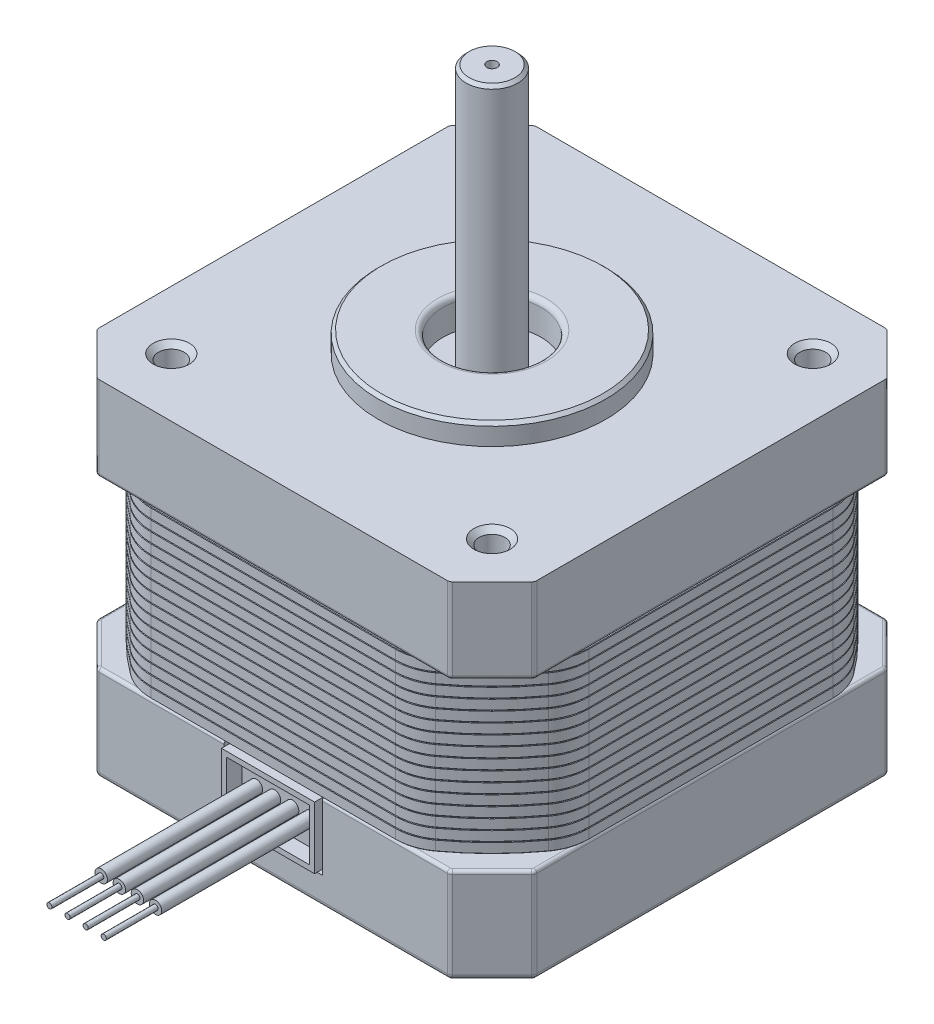
from build123d import *

# Parameters (mm, degrees)
EXTRUDE_1_DEPTH        = 9.2
EXTRUDE_START          = 33.4
EXTRUDE_2_DEPTH        = 8.2
EXTRUDE_3_DEPTH        = 1
PATTERN_LINEAR_1_COUNT = 16
PATTERN_LINEAR_1_PITCH = 1
SKETCH_3_R             = 4.75
CUT_EXTRUDE_1_DEPTH    = 3
SKETCH_4_R             = 4.75
SKETCH_4_R_2           = 2.5
CUT_EXTRUDE_2_DEPTH    = 0.5
SKETCH_5_R             = 0.5
CUT_EXTRUDE_3_DEPTH    = 0.5
CHAMFER_1_SIZE         = 0.3
FILLET_1_R             = 0.5
FILLET_2_R             = 0.5
SKETCH_6_R             = 11
SKETCH_6_R_2           = 4.75
EXTRUDE_4_DEPTH        = 2
CUT_EXTRUDE_START      = -1
SKETCH_7_R             = 4.75
CUT_EXTRUDE_4_DEPTH    = 1
CHAMFER_2_SIZE         = 0.3
FILLET_3_R             = 0.5
SKETCH_8_R             = 2.5
EXTRUDE_5_DEPTH        = 25.2
CHAMFER_4_SIZE         = 0.3
SKETCH_9_R             = 0.5
CUT_EXTRUDE_5_DEPTH    = 1
SKETCH_10_W            = 9.5
SKETCH_10_H            = 6.5
CUT_EXTRUDE_6_DEPTH    = 1
SKETCH_11_W            = 9
SKETCH_11_H            = 6
SKETCH_11_W_2          = 8
SKETCH_11_H_2          = 5
EXTRUDE_6_DEPTH        = 1.5
SKETCH_12_R            = 0.6
SKETCH_12_R_2          = 0.25
EXTRUDE_7_DEPTH        = 15
EXTRUDE_7_2_DEPTH      = 15
EXTRUDE_7_3_DEPTH      = 15
EXTRUDE_7_4_DEPTH      = 15
SKETCH_12_2_R          = 0.25
EXTRUDE_8_DEPTH        = 20
EXTRUDE_8_2_DEPTH      = 20
EXTRUDE_8_3_DEPTH      = 20
EXTRUDE_8_4_DEPTH      = 20
CHAMFER_19_SIZE        = 0.05
CHAMFER_20_SIZE        = 0.05
CHAMFER_21_SIZE        = 0.05
CHAMFER_22_SIZE        = 0.05
CHAMFER_23_SIZE        = 0.05
CHAMFER_24_SIZE        = 0.05
CHAMFER_25_SIZE        = 0.05
CHAMFER_26_SIZE        = 0.05
CHAMFER_27_SIZE        = 0.05
CHAMFER_28_SIZE        = 0.05
CHAMFER_29_SIZE        = 0.05
CHAMFER_30_SIZE        = 0.05
CHAMFER_31_SIZE        = 0.05
CHAMFER_32_SIZE        = 0.05
CHAMFER_33_SIZE        = 0.05
CHAMFER_34_SIZE        = 0.05
SKETCH_16_R            = 1.25
CUT_EXTRUDE_9_DEPTH    = 7
CHAMFER_35_SIZE        = 0.5
FILLET_4_R             = 0.3
FILLET_5_R             = 0.3


with BuildPart() as part:
    # Эскиз1 → Бобышка-Вытянуть1 (new body)
    with BuildSketch(Plane(origin=(0, 0, 0), x_dir=(1, 0, 0), z_dir=(0, 1, 0))):
        Polygon((-17.033766184, 21.15), (-21.15, 17.033766184), (-21.15, -17.033766184), (-17.033766184, -21.15), (17.033766184, -21.15), (21.15, -17.033766184), (21.15, 17.033766184), (17.033766184, 21.15), align=None)
    extrude(amount=EXTRUDE_1_DEPTH)

    # Эскиз3 → Вырез-Вытянуть1 (cut)
    with BuildSketch(Plane.XZ):
        with Locations(Location((0, 0, 0), (0, 0, 270))):
            Circle(SKETCH_3_R)
    extrude(amount=-CUT_EXTRUDE_1_DEPTH, mode=Mode.SUBTRACT)

    # Эскиз4 → Вырез-Вытянуть2 (cut)
    with BuildSketch(Plane.XZ.offset(-3)):
        with Locations(Location((0, 0, 0), (0, 0, 270))):
            Circle(SKETCH_4_R)
        with Locations(Location((0, 0, 0), (0, 0, 270))):
            Circle(SKETCH_4_R_2, mode=Mode.SUBTRACT)
    extrude(amount=-CUT_EXTRUDE_2_DEPTH, mode=Mode.SUBTRACT)

    # Эскиз5 → Вырез-Вытянуть3 (cut)
    with BuildSketch(Plane.XZ.offset(-3)):
        with Locations(Location((0, 0, 0), (0, 0, 270))):
            Circle(SKETCH_5_R)
    extrude(amount=-CUT_EXTRUDE_3_DEPTH, mode=Mode.SUBTRACT)

    # Фаска1
    chamfer_1_edges = [part.edges().sort_by_distance(p)[0] for p in [
        (0, 3, 2.5),
    ]]
    chamfer(chamfer_1_edges, length=CHAMFER_1_SIZE)

    # Скругление1
    fillet_1_edges = [part.edges().sort_by_distance(p)[0] for p in [
        (-21.15, 0, 0),
        (-19.091883092, 0, -19.091883092),
        (0, 0, -21.15),
        (19.091883092, 0, -19.091883092),
        (21.15, 0, 0),
        (19.091883092, 0, 19.091883092),
        (0, 0, 21.15),
        (-19.091883092, 0, 19.091883092),
        (-21.15, 4.6, 17.033766184),
        (-21.15, 4.6, -17.033766184),
        (-17.033766184, 4.6, -21.15),
        (17.033766184, 4.6, -21.15),
        (21.15, 4.6, -17.033766184),
        (21.15, 4.6, 17.033766184),
        (17.033766184, 4.6, 21.15),
        (-17.033766184, 4.6, 21.15),
        (0, 0, 4.75),
    ]]
    fillet(fillet_1_edges, radius=FILLET_1_R)

    # Эскиз10 → Вырез-Вытянуть6 (cut)
    with BuildSketch(Plane.XY.offset(21.15)):
        with Locations((0, 5.95)):
            Rectangle(SKETCH_10_W, SKETCH_10_H)
    extrude(amount=-CUT_EXTRUDE_6_DEPTH, mode=Mode.SUBTRACT)

    # Скругление4
    fillet_4_edges = [part.edges().sort_by_distance(p)[0] for p in [
        (10.788329701, 9.2, 21.15),
        (-10.788329701, 9.2, 21.15),
        (19.091883092, 9.2, 19.091883092),
        (21.15, 9.2, 0),
        (19.091883092, 9.2, -19.091883092),
        (0, 9.2, -21.15),
        (-19.091883092, 9.2, -19.091883092),
        (-21.15, 9.2, 0),
        (-19.091883092, 9.2, 19.091883092),
        (21.111939766, 9.2, -17.018001119),
        (17.018001119, 9.2, -21.111939766),
        (-17.018001119, 9.2, -21.111939766),
        (-21.111939766, 9.2, -17.018001119),
        (-21.111939766, 9.2, 17.018001119),
        (-17.018001119, 9.2, 21.111939766),
        (17.018001119, 9.2, 21.111939766),
        (21.111939766, 9.2, 17.018001119),
    ]]
    fillet(fillet_4_edges, radius=FILLET_4_R)


with BuildPart() as body_2:
    # Эскиз1<3> → Бобышка-Вытянуть2 (new body)
    with BuildSketch(Plane(origin=(0, 0, 0), x_dir=(1, 0, 0), z_dir=(0, 1, 0)).offset(EXTRUDE_START)):
        Polygon((-17.033766184, 21.15), (-21.15, 17.033766184), (-21.15, -17.033766184), (-17.033766184, -21.15), (17.033766184, -21.15), (21.15, -17.033766184), (21.15, 17.033766184), (17.033766184, 21.15), align=None)
    extrude(amount=-EXTRUDE_2_DEPTH)

    # Скругление2
    fillet_2_edges = [body_2.edges().sort_by_distance(p)[0] for p in [
        (-21.15, 29.3, 17.033766184),
        (-21.15, 29.3, -17.033766184),
        (-17.033766184, 29.3, -21.15),
        (17.033766184, 29.3, -21.15),
        (21.15, 29.3, -17.033766184),
        (21.15, 29.3, 17.033766184),
        (17.033766184, 29.3, 21.15),
        (-17.033766184, 29.3, 21.15),
    ]]
    fillet(fillet_2_edges, radius=FILLET_2_R)

    # Эскиз6 → Бобышка-Вытянуть4 (add)
    with BuildSketch(Plane(origin=(0, 33.4, 0), x_dir=(1, 0, 0), z_dir=(0, 1, 0))):
        with Locations(Location((0, 0, 0), (0, 0, 270))):
            Circle(SKETCH_6_R)
        with Locations(Location((0, 0, 0), (0, 0, 270))):
            Circle(SKETCH_6_R_2, mode=Mode.SUBTRACT)
    extrude(amount=EXTRUDE_4_DEPTH)

    # Эскиз7 → Вырез-Вытянуть4 (cut)
    with BuildSketch(Plane(origin=(0, 33.4, 0), x_dir=(1, 0, 0), z_dir=(0, 1, 0)).offset(CUT_EXTRUDE_START)):
        with Locations(Location((0, 0, 0), (0, 0, 270))):
            Circle(SKETCH_7_R)
    extrude(amount=CUT_EXTRUDE_4_DEPTH, mode=Mode.SUBTRACT)

    # Фаска2
    chamfer_2_edges = [body_2.edges().sort_by_distance(p)[0] for p in [
        (0, 35.4, -11),
    ]]
    chamfer(chamfer_2_edges, length=CHAMFER_2_SIZE)

    # Скругление3
    fillet_3_edges = [body_2.edges().sort_by_distance(p)[0] for p in [
        (0, 35.4, -4.75),
    ]]
    fillet(fillet_3_edges, radius=FILLET_3_R)

    # Эскиз8 → Бобышка-Вытянуть5 (add)
    with BuildSketch(Plane(origin=(0, 32.4, 0), x_dir=(1, 0, 0), z_dir=(0, 1, 0))):
        with Locations(Location((0, 0, 0), (0, 0, 270))):
            Circle(SKETCH_8_R)
    extrude(amount=EXTRUDE_5_DEPTH)

    # Фаска4
    chamfer_4_edges = [body_2.edges().sort_by_distance(p)[0] for p in [
        (0, 57.6, -2.5),
    ]]
    chamfer(chamfer_4_edges, length=CHAMFER_4_SIZE)

    # Эскиз9 → Вырез-Вытянуть5 (cut)
    with BuildSketch(Plane(origin=(0, 57.6, 0), x_dir=(1, 0, 0), z_dir=(0, 1, 0)).offset(CUT_EXTRUDE_START)):
        with Locations(Location((0, 0, 0), (0, 0, 270))):
            Circle(SKETCH_9_R)
    extrude(amount=CUT_EXTRUDE_5_DEPTH, mode=Mode.SUBTRACT)

    # Эскиз16 → Вырез-Вытянуть9 (cut)
    with BuildSketch(Plane(origin=(0, 33.4, 0), x_dir=(1, 0, 0), z_dir=(0, 1, 0))):
        with Locations(Location((-15.5, 15.5, 0), (0, 0, 270))):
            Circle(SKETCH_16_R)
        with Locations(Location((15.5, 15.5, 0), (0, 0, 270))):
            Circle(SKETCH_16_R)
        with Locations(Location((15.5, -15.5, 0), (0, 0, 270))):
            Circle(SKETCH_16_R)
        with Locations(Location((-15.5, -15.5, 0), (0, 0, 270))):
            Circle(SKETCH_16_R)
    extrude(amount=-CUT_EXTRUDE_9_DEPTH, mode=Mode.SUBTRACT)

    # Фаска35
    chamfer_35_edges = [body_2.edges().sort_by_distance(p)[0] for p in [
        (-15.5, 33.4, -16.75),
        (15.5, 33.4, -16.75),
        (15.5, 33.4, 14.25),
        (-15.5, 33.4, 14.25),
    ]]
    chamfer(chamfer_35_edges, length=CHAMFER_35_SIZE)

    # Скругление5
    fillet_5_edges = [body_2.edges().sort_by_distance(p)[0] for p in [
        (19.091883092, 25.2, 19.091883092),
        (21.15, 25.2, 0),
        (-19.091883092, 25.2, 19.091883092),
        (-21.15, 25.2, 0),
        (-19.091883092, 25.2, -19.091883092),
        (0, 25.2, -21.15),
        (19.091883092, 25.2, -19.091883092),
        (0, 25.2, 21.15),
        (21.111939766, 25.2, -17.018001119),
        (17.018001119, 25.2, -21.111939766),
        (-17.018001119, 25.2, -21.111939766),
        (-21.111939766, 25.2, -17.018001119),
        (-21.111939766, 25.2, 17.018001119),
        (-17.018001119, 25.2, 21.111939766),
        (17.018001119, 25.2, 21.111939766),
        (21.111939766, 25.2, 17.018001119),
    ]]
    fillet(fillet_5_edges, radius=FILLET_5_R)


with BuildPart() as body_3:
    # Эскиз2 → Бобышка-Вытянуть3 (new body)
    with BuildSketch(Plane(origin=(0, 9.2, 0), x_dir=(1, 0, 0), z_dir=(0, 1, 0))):
        with BuildLine():
            Line((-11.797351398, -21.15), (11.797351398, -21.15))
            ThreePointArc((11.797351398, -21.15), (13.348560603, -20.903288335), (14.746689247, -20.1875))
            ThreePointArc((14.746689247, -20.1875), (17.67766953, -17.67766953), (20.1875, -14.746689247))
            ThreePointArc((20.1875, -14.746689247), (20.903288335, -13.348560603), (21.15, -11.797351398))
            Line((21.15, -11.797351398), (21.15, 11.797351398))
            ThreePointArc((21.15, 11.797351398), (20.903288335, 13.348560603), (20.1875, 14.746689247))
            ThreePointArc((20.1875, 14.746689247), (17.67766953, 17.67766953), (14.746689247, 20.1875))
            ThreePointArc((14.746689247, 20.1875), (13.348560603, 20.903288335), (11.797351398, 21.15))
            Line((11.797351398, 21.15), (-11.797351398, 21.15))
            ThreePointArc((-11.797351398, 21.15), (-13.348560603, 20.903288335), (-14.746689247, 20.1875))
            ThreePointArc((-14.746689247, 20.1875), (-17.67766953, 17.67766953), (-20.1875, 14.746689247))
            ThreePointArc((-20.1875, 14.746689247), (-20.903288335, 13.348560603), (-21.15, 11.797351398))
            Line((-21.15, 11.797351398), (-21.15, -11.797351398))
            ThreePointArc((-21.15, -11.797351398), (-20.903288335, -13.348560603), (-20.1875, -14.746689247))
            ThreePointArc((-20.1875, -14.746689247), (-17.67766953, -17.67766953), (-14.746689247, -20.1875))
            ThreePointArc((-14.746689247, -20.1875), (-13.348560603, -20.903288335), (-11.797351398, -21.15))
        make_face()
    extrude(amount=EXTRUDE_3_DEPTH)


with BuildPart() as pattern_linear_1_1:
    # Линейный массив1: pattern copy
    add(body_3.part.moved(Location(Vector(0, 1, 0) * (1 * PATTERN_LINEAR_1_PITCH))))

    # Фаска33
    chamfer_33_edges = [pattern_linear_1_1.edges().sort_by_distance(p)[0] for p in [
        (-13.348560603, 11.2, -20.903288335),
        (-17.67766953, 11.2, -17.67766953),
        (17.67766953, 10.2, -17.67766953),
        (20.903288335, 10.2, -13.348560603),
        (21.15, 10.2, 0),
        (20.903288335, 10.2, 13.348560603),
        (17.67766953, 10.2, 17.67766953),
        (-20.903288335, 11.2, -13.348560603),
        (13.348560603, 10.2, 20.903288335),
        (0, 10.2, 21.15),
        (-13.348560603, 10.2, 20.903288335),
        (-17.67766953, 10.2, 17.67766953),
        (-20.903288335, 10.2, 13.348560603),
        (-21.15, 10.2, 0),
        (-20.903288335, 10.2, -13.348560603),
        (-17.67766953, 10.2, -17.67766953),
        (-21.15, 11.2, 0),
        (-13.348560603, 10.2, -20.903288335),
        (0, 10.2, -21.15),
        (13.348560603, 10.2, -20.903288335),
        (-20.903288335, 11.2, 13.348560603),
        (-17.67766953, 11.2, 17.67766953),
        (-13.348560603, 11.2, 20.903288335),
        (0, 11.2, 21.15),
        (13.348560603, 11.2, 20.903288335),
        (17.67766953, 11.2, 17.67766953),
        (13.348560603, 11.2, -20.903288335),
        (20.903288335, 11.2, 13.348560603),
        (21.15, 11.2, 0),
        (20.903288335, 11.2, -13.348560603),
        (17.67766953, 11.2, -17.67766953),
        (0, 11.2, -21.15),
    ]]
    chamfer(chamfer_33_edges, length=CHAMFER_33_SIZE)


with BuildPart() as pattern_linear_1_2:
    # Линейный массив1: pattern copy
    add(body_3.part.moved(Location(Vector(0, 1, 0) * (2 * PATTERN_LINEAR_1_PITCH))))

    # Фаска32
    chamfer_32_edges = [pattern_linear_1_2.edges().sort_by_distance(p)[0] for p in [
        (-13.348560603, 12.2, -20.903288335),
        (-17.67766953, 12.2, -17.67766953),
        (17.67766953, 11.2, -17.67766953),
        (20.903288335, 11.2, -13.348560603),
        (21.15, 11.2, 0),
        (20.903288335, 11.2, 13.348560603),
        (17.67766953, 11.2, 17.67766953),
        (-20.903288335, 12.2, -13.348560603),
        (13.348560603, 11.2, 20.903288335),
        (0, 11.2, 21.15),
        (-13.348560603, 11.2, 20.903288335),
        (-17.67766953, 11.2, 17.67766953),
        (-20.903288335, 11.2, 13.348560603),
        (-21.15, 11.2, 0),
        (-20.903288335, 11.2, -13.348560603),
        (-17.67766953, 11.2, -17.67766953),
        (-21.15, 12.2, 0),
        (-13.348560603, 11.2, -20.903288335),
        (0, 11.2, -21.15),
        (13.348560603, 11.2, -20.903288335),
        (-20.903288335, 12.2, 13.348560603),
        (-17.67766953, 12.2, 17.67766953),
        (-13.348560603, 12.2, 20.903288335),
        (0, 12.2, 21.15),
        (13.348560603, 12.2, 20.903288335),
        (17.67766953, 12.2, 17.67766953),
        (13.348560603, 12.2, -20.903288335),
        (20.903288335, 12.2, 13.348560603),
        (21.15, 12.2, 0),
        (20.903288335, 12.2, -13.348560603),
        (17.67766953, 12.2, -17.67766953),
        (0, 12.2, -21.15),
    ]]
    chamfer(chamfer_32_edges, length=CHAMFER_32_SIZE)


with BuildPart() as pattern_linear_1_3:
    # Линейный массив1: pattern copy
    add(body_3.part.moved(Location(Vector(0, 1, 0) * (3 * PATTERN_LINEAR_1_PITCH))))

    # Фаска31
    chamfer_31_edges = [pattern_linear_1_3.edges().sort_by_distance(p)[0] for p in [
        (-13.348560603, 13.2, -20.903288335),
        (-17.67766953, 13.2, -17.67766953),
        (17.67766953, 12.2, -17.67766953),
        (20.903288335, 12.2, -13.348560603),
        (21.15, 12.2, 0),
        (20.903288335, 12.2, 13.348560603),
        (17.67766953, 12.2, 17.67766953),
        (-20.903288335, 13.2, -13.348560603),
        (13.348560603, 12.2, 20.903288335),
        (0, 12.2, 21.15),
        (-13.348560603, 12.2, 20.903288335),
        (-17.67766953, 12.2, 17.67766953),
        (-20.903288335, 12.2, 13.348560603),
        (-21.15, 12.2, 0),
        (-20.903288335, 12.2, -13.348560603),
        (-17.67766953, 12.2, -17.67766953),
        (-21.15, 13.2, 0),
        (-13.348560603, 12.2, -20.903288335),
        (0, 12.2, -21.15),
        (13.348560603, 12.2, -20.903288335),
        (-20.903288335, 13.2, 13.348560603),
        (-17.67766953, 13.2, 17.67766953),
        (-13.348560603, 13.2, 20.903288335),
        (0, 13.2, 21.15),
        (13.348560603, 13.2, 20.903288335),
        (17.67766953, 13.2, 17.67766953),
        (13.348560603, 13.2, -20.903288335),
        (20.903288335, 13.2, 13.348560603),
        (21.15, 13.2, 0),
        (20.903288335, 13.2, -13.348560603),
        (17.67766953, 13.2, -17.67766953),
        (0, 13.2, -21.15),
    ]]
    chamfer(chamfer_31_edges, length=CHAMFER_31_SIZE)


with BuildPart() as pattern_linear_1_4:
    # Линейный массив1: pattern copy
    add(body_3.part.moved(Location(Vector(0, 1, 0) * (4 * PATTERN_LINEAR_1_PITCH))))

    # Фаска30
    chamfer_30_edges = [pattern_linear_1_4.edges().sort_by_distance(p)[0] for p in [
        (-13.348560603, 14.2, -20.903288335),
        (-17.67766953, 14.2, -17.67766953),
        (17.67766953, 13.2, -17.67766953),
        (20.903288335, 13.2, -13.348560603),
        (21.15, 13.2, 0),
        (20.903288335, 13.2, 13.348560603),
        (17.67766953, 13.2, 17.67766953),
        (-20.903288335, 14.2, -13.348560603),
        (13.348560603, 13.2, 20.903288335),
        (0, 13.2, 21.15),
        (-13.348560603, 13.2, 20.903288335),
        (-17.67766953, 13.2, 17.67766953),
        (-20.903288335, 13.2, 13.348560603),
        (-21.15, 13.2, 0),
        (-20.903288335, 13.2, -13.348560603),
        (-17.67766953, 13.2, -17.67766953),
        (-21.15, 14.2, 0),
        (-13.348560603, 13.2, -20.903288335),
        (0, 13.2, -21.15),
        (13.348560603, 13.2, -20.903288335),
        (-20.903288335, 14.2, 13.348560603),
        (-17.67766953, 14.2, 17.67766953),
        (-13.348560603, 14.2, 20.903288335),
        (0, 14.2, 21.15),
        (13.348560603, 14.2, 20.903288335),
        (17.67766953, 14.2, 17.67766953),
        (13.348560603, 14.2, -20.903288335),
        (20.903288335, 14.2, 13.348560603),
        (21.15, 14.2, 0),
        (20.903288335, 14.2, -13.348560603),
        (17.67766953, 14.2, -17.67766953),
        (0, 14.2, -21.15),
    ]]
    chamfer(chamfer_30_edges, length=CHAMFER_30_SIZE)


with BuildPart() as pattern_linear_1_5:
    # Линейный массив1: pattern copy
    add(body_3.part.moved(Location(Vector(0, 1, 0) * (5 * PATTERN_LINEAR_1_PITCH))))

    # Фаска29
    chamfer_29_edges = [pattern_linear_1_5.edges().sort_by_distance(p)[0] for p in [
        (-13.348560603, 15.2, -20.903288335),
        (-17.67766953, 15.2, -17.67766953),
        (17.67766953, 14.2, -17.67766953),
        (20.903288335, 14.2, -13.348560603),
        (21.15, 14.2, 0),
        (20.903288335, 14.2, 13.348560603),
        (17.67766953, 14.2, 17.67766953),
        (-20.903288335, 15.2, -13.348560603),
        (13.348560603, 14.2, 20.903288335),
        (0, 14.2, 21.15),
        (-13.348560603, 14.2, 20.903288335),
        (-17.67766953, 14.2, 17.67766953),
        (-20.903288335, 14.2, 13.348560603),
        (-21.15, 14.2, 0),
        (-20.903288335, 14.2, -13.348560603),
        (-17.67766953, 14.2, -17.67766953),
        (-21.15, 15.2, 0),
        (-13.348560603, 14.2, -20.903288335),
        (0, 14.2, -21.15),
        (13.348560603, 14.2, -20.903288335),
        (-20.903288335, 15.2, 13.348560603),
        (-17.67766953, 15.2, 17.67766953),
        (-13.348560603, 15.2, 20.903288335),
        (0, 15.2, 21.15),
        (13.348560603, 15.2, 20.903288335),
        (17.67766953, 15.2, 17.67766953),
        (13.348560603, 15.2, -20.903288335),
        (20.903288335, 15.2, 13.348560603),
        (21.15, 15.2, 0),
        (20.903288335, 15.2, -13.348560603),
        (17.67766953, 15.2, -17.67766953),
        (0, 15.2, -21.15),
    ]]
    chamfer(chamfer_29_edges, length=CHAMFER_29_SIZE)


with BuildPart() as pattern_linear_1_6:
    # Линейный массив1: pattern copy
    add(body_3.part.moved(Location(Vector(0, 1, 0) * (6 * PATTERN_LINEAR_1_PITCH))))

    # Фаска28
    chamfer_28_edges = [pattern_linear_1_6.edges().sort_by_distance(p)[0] for p in [
        (-13.348560603, 16.2, -20.903288335),
        (-17.67766953, 16.2, -17.67766953),
        (17.67766953, 15.2, -17.67766953),
        (20.903288335, 15.2, -13.348560603),
        (21.15, 15.2, 0),
        (20.903288335, 15.2, 13.348560603),
        (17.67766953, 15.2, 17.67766953),
        (-20.903288335, 16.2, -13.348560603),
        (13.348560603, 15.2, 20.903288335),
        (0, 15.2, 21.15),
        (-13.348560603, 15.2, 20.903288335),
        (-17.67766953, 15.2, 17.67766953),
        (-20.903288335, 15.2, 13.348560603),
        (-21.15, 15.2, 0),
        (-20.903288335, 15.2, -13.348560603),
        (-17.67766953, 15.2, -17.67766953),
        (-21.15, 16.2, 0),
        (-13.348560603, 15.2, -20.903288335),
        (0, 15.2, -21.15),
        (13.348560603, 15.2, -20.903288335),
        (-20.903288335, 16.2, 13.348560603),
        (-17.67766953, 16.2, 17.67766953),
        (-13.348560603, 16.2, 20.903288335),
        (0, 16.2, 21.15),
        (13.348560603, 16.2, 20.903288335),
        (17.67766953, 16.2, 17.67766953),
        (13.348560603, 16.2, -20.903288335),
        (20.903288335, 16.2, 13.348560603),
        (21.15, 16.2, 0),
        (20.903288335, 16.2, -13.348560603),
        (17.67766953, 16.2, -17.67766953),
        (0, 16.2, -21.15),
    ]]
    chamfer(chamfer_28_edges, length=CHAMFER_28_SIZE)


with BuildPart() as pattern_linear_1_7:
    # Линейный массив1: pattern copy
    add(body_3.part.moved(Location(Vector(0, 1, 0) * (7 * PATTERN_LINEAR_1_PITCH))))

    # Фаска27
    chamfer_27_edges = [pattern_linear_1_7.edges().sort_by_distance(p)[0] for p in [
        (-13.348560603, 17.2, -20.903288335),
        (-17.67766953, 17.2, -17.67766953),
        (17.67766953, 16.2, -17.67766953),
        (20.903288335, 16.2, -13.348560603),
        (21.15, 16.2, 0),
        (20.903288335, 16.2, 13.348560603),
        (17.67766953, 16.2, 17.67766953),
        (-20.903288335, 17.2, -13.348560603),
        (13.348560603, 16.2, 20.903288335),
        (0, 16.2, 21.15),
        (-13.348560603, 16.2, 20.903288335),
        (-17.67766953, 16.2, 17.67766953),
        (-20.903288335, 16.2, 13.348560603),
        (-21.15, 16.2, 0),
        (-20.903288335, 16.2, -13.348560603),
        (-17.67766953, 16.2, -17.67766953),
        (-21.15, 17.2, 0),
        (-13.348560603, 16.2, -20.903288335),
        (0, 16.2, -21.15),
        (13.348560603, 16.2, -20.903288335),
        (-20.903288335, 17.2, 13.348560603),
        (-17.67766953, 17.2, 17.67766953),
        (-13.348560603, 17.2, 20.903288335),
        (0, 17.2, 21.15),
        (13.348560603, 17.2, 20.903288335),
        (17.67766953, 17.2, 17.67766953),
        (13.348560603, 17.2, -20.903288335),
        (20.903288335, 17.2, 13.348560603),
        (21.15, 17.2, 0),
        (20.903288335, 17.2, -13.348560603),
        (17.67766953, 17.2, -17.67766953),
        (0, 17.2, -21.15),
    ]]
    chamfer(chamfer_27_edges, length=CHAMFER_27_SIZE)


with BuildPart() as pattern_linear_1_8:
    # Линейный массив1: pattern copy
    add(body_3.part.moved(Location(Vector(0, 1, 0) * (8 * PATTERN_LINEAR_1_PITCH))))

    # Фаска26
    chamfer_26_edges = [pattern_linear_1_8.edges().sort_by_distance(p)[0] for p in [
        (-13.348560603, 18.2, -20.903288335),
        (-17.67766953, 18.2, -17.67766953),
        (17.67766953, 17.2, -17.67766953),
        (20.903288335, 17.2, -13.348560603),
        (21.15, 17.2, 0),
        (20.903288335, 17.2, 13.348560603),
        (17.67766953, 17.2, 17.67766953),
        (-20.903288335, 18.2, -13.348560603),
        (13.348560603, 17.2, 20.903288335),
        (0, 17.2, 21.15),
        (-13.348560603, 17.2, 20.903288335),
        (-17.67766953, 17.2, 17.67766953),
        (-20.903288335, 17.2, 13.348560603),
        (-21.15, 17.2, 0),
        (-20.903288335, 17.2, -13.348560603),
        (-17.67766953, 17.2, -17.67766953),
        (-21.15, 18.2, 0),
        (-13.348560603, 17.2, -20.903288335),
        (0, 17.2, -21.15),
        (13.348560603, 17.2, -20.903288335),
        (-20.903288335, 18.2, 13.348560603),
        (-17.67766953, 18.2, 17.67766953),
        (-13.348560603, 18.2, 20.903288335),
        (0, 18.2, 21.15),
        (13.348560603, 18.2, 20.903288335),
        (17.67766953, 18.2, 17.67766953),
        (13.348560603, 18.2, -20.903288335),
        (20.903288335, 18.2, 13.348560603),
        (21.15, 18.2, 0),
        (20.903288335, 18.2, -13.348560603),
        (17.67766953, 18.2, -17.67766953),
        (0, 18.2, -21.15),
    ]]
    chamfer(chamfer_26_edges, length=CHAMFER_26_SIZE)


with BuildPart() as pattern_linear_1_9:
    # Линейный массив1: pattern copy
    add(body_3.part.moved(Location(Vector(0, 1, 0) * (9 * PATTERN_LINEAR_1_PITCH))))

    # Фаска25
    chamfer_25_edges = [pattern_linear_1_9.edges().sort_by_distance(p)[0] for p in [
        (-13.348560603, 19.2, -20.903288335),
        (-17.67766953, 19.2, -17.67766953),
        (17.67766953, 18.2, -17.67766953),
        (20.903288335, 18.2, -13.348560603),
        (21.15, 18.2, 0),
        (20.903288335, 18.2, 13.348560603),
        (17.67766953, 18.2, 17.67766953),
        (-20.903288335, 19.2, -13.348560603),
        (13.348560603, 18.2, 20.903288335),
        (0, 18.2, 21.15),
        (-13.348560603, 18.2, 20.903288335),
        (-17.67766953, 18.2, 17.67766953),
        (-20.903288335, 18.2, 13.348560603),
        (-21.15, 18.2, 0),
        (-20.903288335, 18.2, -13.348560603),
        (-17.67766953, 18.2, -17.67766953),
        (-21.15, 19.2, 0),
        (-13.348560603, 18.2, -20.903288335),
        (0, 18.2, -21.15),
        (13.348560603, 18.2, -20.903288335),
        (-20.903288335, 19.2, 13.348560603),
        (-17.67766953, 19.2, 17.67766953),
        (-13.348560603, 19.2, 20.903288335),
        (0, 19.2, 21.15),
        (13.348560603, 19.2, 20.903288335),
        (17.67766953, 19.2, 17.67766953),
        (13.348560603, 19.2, -20.903288335),
        (20.903288335, 19.2, 13.348560603),
        (21.15, 19.2, 0),
        (20.903288335, 19.2, -13.348560603),
        (17.67766953, 19.2, -17.67766953),
        (0, 19.2, -21.15),
    ]]
    chamfer(chamfer_25_edges, length=CHAMFER_25_SIZE)


with BuildPart() as pattern_linear_1_10:
    # Линейный массив1: pattern copy
    add(body_3.part.moved(Location(Vector(0, 1, 0) * (10 * PATTERN_LINEAR_1_PITCH))))

    # Фаска24
    chamfer_24_edges = [pattern_linear_1_10.edges().sort_by_distance(p)[0] for p in [
        (-13.348560603, 20.2, -20.903288335),
        (-17.67766953, 20.2, -17.67766953),
        (17.67766953, 19.2, -17.67766953),
        (20.903288335, 19.2, -13.348560603),
        (21.15, 19.2, 0),
        (20.903288335, 19.2, 13.348560603),
        (17.67766953, 19.2, 17.67766953),
        (-20.903288335, 20.2, -13.348560603),
        (13.348560603, 19.2, 20.903288335),
        (0, 19.2, 21.15),
        (-13.348560603, 19.2, 20.903288335),
        (-17.67766953, 19.2, 17.67766953),
        (-20.903288335, 19.2, 13.348560603),
        (-21.15, 19.2, 0),
        (-20.903288335, 19.2, -13.348560603),
        (-17.67766953, 19.2, -17.67766953),
        (-21.15, 20.2, 0),
        (-13.348560603, 19.2, -20.903288335),
        (0, 19.2, -21.15),
        (13.348560603, 19.2, -20.903288335),
        (-20.903288335, 20.2, 13.348560603),
        (-17.67766953, 20.2, 17.67766953),
        (-13.348560603, 20.2, 20.903288335),
        (0, 20.2, 21.15),
        (13.348560603, 20.2, 20.903288335),
        (17.67766953, 20.2, 17.67766953),
        (13.348560603, 20.2, -20.903288335),
        (20.903288335, 20.2, 13.348560603),
        (21.15, 20.2, 0),
        (20.903288335, 20.2, -13.348560603),
        (17.67766953, 20.2, -17.67766953),
        (0, 20.2, -21.15),
    ]]
    chamfer(chamfer_24_edges, length=CHAMFER_24_SIZE)


with BuildPart() as pattern_linear_1_11:
    # Линейный массив1: pattern copy
    add(body_3.part.moved(Location(Vector(0, 1, 0) * (11 * PATTERN_LINEAR_1_PITCH))))

    # Фаска23
    chamfer_23_edges = [pattern_linear_1_11.edges().sort_by_distance(p)[0] for p in [
        (-13.348560603, 21.2, -20.903288335),
        (-17.67766953, 21.2, -17.67766953),
        (17.67766953, 20.2, -17.67766953),
        (20.903288335, 20.2, -13.348560603),
        (21.15, 20.2, 0),
        (20.903288335, 20.2, 13.348560603),
        (17.67766953, 20.2, 17.67766953),
        (-20.903288335, 21.2, -13.348560603),
        (13.348560603, 20.2, 20.903288335),
        (0, 20.2, 21.15),
        (-13.348560603, 20.2, 20.903288335),
        (-17.67766953, 20.2, 17.67766953),
        (-20.903288335, 20.2, 13.348560603),
        (-21.15, 20.2, 0),
        (-20.903288335, 20.2, -13.348560603),
        (-17.67766953, 20.2, -17.67766953),
        (-21.15, 21.2, 0),
        (-13.348560603, 20.2, -20.903288335),
        (0, 20.2, -21.15),
        (13.348560603, 20.2, -20.903288335),
        (-20.903288335, 21.2, 13.348560603),
        (-17.67766953, 21.2, 17.67766953),
        (-13.348560603, 21.2, 20.903288335),
        (0, 21.2, 21.15),
        (13.348560603, 21.2, 20.903288335),
        (17.67766953, 21.2, 17.67766953),
        (13.348560603, 21.2, -20.903288335),
        (20.903288335, 21.2, 13.348560603),
        (21.15, 21.2, 0),
        (20.903288335, 21.2, -13.348560603),
        (17.67766953, 21.2, -17.67766953),
        (0, 21.2, -21.15),
    ]]
    chamfer(chamfer_23_edges, length=CHAMFER_23_SIZE)


with BuildPart() as pattern_linear_1_12:
    # Линейный массив1: pattern copy
    add(body_3.part.moved(Location(Vector(0, 1, 0) * (12 * PATTERN_LINEAR_1_PITCH))))

    # Фаска22
    chamfer_22_edges = [pattern_linear_1_12.edges().sort_by_distance(p)[0] for p in [
        (-13.348560603, 22.2, -20.903288335),
        (-17.67766953, 22.2, -17.67766953),
        (17.67766953, 21.2, -17.67766953),
        (20.903288335, 21.2, -13.348560603),
        (21.15, 21.2, 0),
        (20.903288335, 21.2, 13.348560603),
        (17.67766953, 21.2, 17.67766953),
        (-20.903288335, 22.2, -13.348560603),
        (13.348560603, 21.2, 20.903288335),
        (0, 21.2, 21.15),
        (-13.348560603, 21.2, 20.903288335),
        (-17.67766953, 21.2, 17.67766953),
        (-20.903288335, 21.2, 13.348560603),
        (-21.15, 21.2, 0),
        (-20.903288335, 21.2, -13.348560603),
        (-17.67766953, 21.2, -17.67766953),
        (-21.15, 22.2, 0),
        (-13.348560603, 21.2, -20.903288335),
        (0, 21.2, -21.15),
        (13.348560603, 21.2, -20.903288335),
        (-20.903288335, 22.2, 13.348560603),
        (-17.67766953, 22.2, 17.67766953),
        (-13.348560603, 22.2, 20.903288335),
        (0, 22.2, 21.15),
        (13.348560603, 22.2, 20.903288335),
        (17.67766953, 22.2, 17.67766953),
        (13.348560603, 22.2, -20.903288335),
        (20.903288335, 22.2, 13.348560603),
        (21.15, 22.2, 0),
        (20.903288335, 22.2, -13.348560603),
        (17.67766953, 22.2, -17.67766953),
        (0, 22.2, -21.15),
    ]]
    chamfer(chamfer_22_edges, length=CHAMFER_22_SIZE)


with BuildPart() as pattern_linear_1_13:
    # Линейный массив1: pattern copy
    add(body_3.part.moved(Location(Vector(0, 1, 0) * (13 * PATTERN_LINEAR_1_PITCH))))

    # Фаска21
    chamfer_21_edges = [pattern_linear_1_13.edges().sort_by_distance(p)[0] for p in [
        (-13.348560603, 23.2, -20.903288335),
        (-17.67766953, 23.2, -17.67766953),
        (17.67766953, 22.2, -17.67766953),
        (20.903288335, 22.2, -13.348560603),
        (21.15, 22.2, 0),
        (20.903288335, 22.2, 13.348560603),
        (17.67766953, 22.2, 17.67766953),
        (-20.903288335, 23.2, -13.348560603),
        (13.348560603, 22.2, 20.903288335),
        (0, 22.2, 21.15),
        (-13.348560603, 22.2, 20.903288335),
        (-17.67766953, 22.2, 17.67766953),
        (-20.903288335, 22.2, 13.348560603),
        (-21.15, 22.2, 0),
        (-20.903288335, 22.2, -13.348560603),
        (-17.67766953, 22.2, -17.67766953),
        (-21.15, 23.2, 0),
        (-13.348560603, 22.2, -20.903288335),
        (0, 22.2, -21.15),
        (13.348560603, 22.2, -20.903288335),
        (-20.903288335, 23.2, 13.348560603),
        (-17.67766953, 23.2, 17.67766953),
        (-13.348560603, 23.2, 20.903288335),
        (0, 23.2, 21.15),
        (13.348560603, 23.2, 20.903288335),
        (17.67766953, 23.2, 17.67766953),
        (13.348560603, 23.2, -20.903288335),
        (20.903288335, 23.2, 13.348560603),
        (21.15, 23.2, 0),
        (20.903288335, 23.2, -13.348560603),
        (17.67766953, 23.2, -17.67766953),
        (0, 23.2, -21.15),
    ]]
    chamfer(chamfer_21_edges, length=CHAMFER_21_SIZE)


with BuildPart() as pattern_linear_1_14:
    # Линейный массив1: pattern copy
    add(body_3.part.moved(Location(Vector(0, 1, 0) * (14 * PATTERN_LINEAR_1_PITCH))))

    # Фаска20
    chamfer_20_edges = [pattern_linear_1_14.edges().sort_by_distance(p)[0] for p in [
        (-13.348560603, 24.2, -20.903288335),
        (-17.67766953, 24.2, -17.67766953),
        (17.67766953, 23.2, -17.67766953),
        (20.903288335, 23.2, -13.348560603),
        (21.15, 23.2, 0),
        (20.903288335, 23.2, 13.348560603),
        (17.67766953, 23.2, 17.67766953),
        (-20.903288335, 24.2, -13.348560603),
        (13.348560603, 23.2, 20.903288335),
        (0, 23.2, 21.15),
        (-13.348560603, 23.2, 20.903288335),
        (-17.67766953, 23.2, 17.67766953),
        (-20.903288335, 23.2, 13.348560603),
        (-21.15, 23.2, 0),
        (-20.903288335, 23.2, -13.348560603),
        (-17.67766953, 23.2, -17.67766953),
        (-21.15, 24.2, 0),
        (-13.348560603, 23.2, -20.903288335),
        (0, 23.2, -21.15),
        (13.348560603, 23.2, -20.903288335),
        (-20.903288335, 24.2, 13.348560603),
        (-17.67766953, 24.2, 17.67766953),
        (-13.348560603, 24.2, 20.903288335),
        (0, 24.2, 21.15),
        (13.348560603, 24.2, 20.903288335),
        (17.67766953, 24.2, 17.67766953),
        (13.348560603, 24.2, -20.903288335),
        (20.903288335, 24.2, 13.348560603),
        (21.15, 24.2, 0),
        (20.903288335, 24.2, -13.348560603),
        (17.67766953, 24.2, -17.67766953),
        (0, 24.2, -21.15),
    ]]
    chamfer(chamfer_20_edges, length=CHAMFER_20_SIZE)


with BuildPart() as pattern_linear_1_15:
    # Линейный массив1: pattern copy
    add(body_3.part.moved(Location(Vector(0, 1, 0) * (15 * PATTERN_LINEAR_1_PITCH))))

    # Фаска19
    chamfer_19_edges = [pattern_linear_1_15.edges().sort_by_distance(p)[0] for p in [
        (-13.348560603, 25.2, -20.903288335),
        (-17.67766953, 25.2, -17.67766953),
        (17.67766953, 24.2, -17.67766953),
        (20.903288335, 24.2, -13.348560603),
        (21.15, 24.2, 0),
        (20.903288335, 24.2, 13.348560603),
        (17.67766953, 24.2, 17.67766953),
        (-20.903288335, 25.2, -13.348560603),
        (13.348560603, 24.2, 20.903288335),
        (0, 24.2, 21.15),
        (-13.348560603, 24.2, 20.903288335),
        (-17.67766953, 24.2, 17.67766953),
        (-20.903288335, 24.2, 13.348560603),
        (-21.15, 24.2, 0),
        (-20.903288335, 24.2, -13.348560603),
        (-17.67766953, 24.2, -17.67766953),
        (-21.15, 25.2, 0),
        (-13.348560603, 24.2, -20.903288335),
        (0, 24.2, -21.15),
        (13.348560603, 24.2, -20.903288335),
        (-20.903288335, 25.2, 13.348560603),
        (-17.67766953, 25.2, 17.67766953),
        (-13.348560603, 25.2, 20.903288335),
        (0, 25.2, 21.15),
        (13.348560603, 25.2, 20.903288335),
        (17.67766953, 25.2, 17.67766953),
        (13.348560603, 25.2, -20.903288335),
        (20.903288335, 25.2, 13.348560603),
        (21.15, 25.2, 0),
        (20.903288335, 25.2, -13.348560603),
        (17.67766953, 25.2, -17.67766953),
        (0, 25.2, -21.15),
    ]]
    chamfer(chamfer_19_edges, length=CHAMFER_19_SIZE)


with BuildPart() as body_19:
    # Эскиз11 → Бобышка-Вытянуть6 (new body)
    with BuildSketch(Plane.XY.offset(20.15)):
        with Locations((0, 5.95)):
            Rectangle(SKETCH_11_W, SKETCH_11_H)
        with Locations((0, 5.95)):
            Rectangle(SKETCH_11_W_2, SKETCH_11_H_2, mode=Mode.SUBTRACT)
    extrude(amount=EXTRUDE_6_DEPTH)


with BuildPart() as body_20:
    # Эскиз12 → Бобышка-Вытянуть7 (new body)
    with BuildSketch(Plane.XY.offset(20.15)):
        with Locations((-2.625, 5.95)):
            Circle(SKETCH_12_R)
        with Locations((-2.625, 5.95)):
            Circle(SKETCH_12_R_2, mode=Mode.SUBTRACT)
    extrude(amount=EXTRUDE_7_DEPTH)


with BuildPart() as body_21:
    # Эскиз12 → Extrude 7 2 (new body)
    with BuildSketch(Plane.XY.offset(20.15)):
        with Locations((-0.875, 5.95)):
            Circle(SKETCH_12_R)
        with Locations((-0.875, 5.95)):
            Circle(SKETCH_12_R_2, mode=Mode.SUBTRACT)
    extrude(amount=EXTRUDE_7_2_DEPTH)


with BuildPart() as body_22:
    # Эскиз12 → Extrude 7 3 (new body)
    with BuildSketch(Plane.XY.offset(20.15)):
        with Locations((0.875, 5.95)):
            Circle(SKETCH_12_R)
        with Locations((0.875, 5.95)):
            Circle(SKETCH_12_R_2, mode=Mode.SUBTRACT)
    extrude(amount=EXTRUDE_7_3_DEPTH)


with BuildPart() as body_23:
    # Эскиз12 → Extrude 7 4 (new body)
    with BuildSketch(Plane.XY.offset(20.15)):
        with Locations((2.625, 5.95)):
            Circle(SKETCH_12_R)
        with Locations((2.625, 5.95)):
            Circle(SKETCH_12_R_2, mode=Mode.SUBTRACT)
    extrude(amount=EXTRUDE_7_4_DEPTH)


with BuildPart() as body_24:
    # Эскиз12<2> → Бобышка-Вытянуть8 (new body)
    with BuildSketch(Plane.XY.offset(20.15)):
        with Locations((-2.625, 5.95)):
            Circle(SKETCH_12_2_R)
    extrude(amount=EXTRUDE_8_DEPTH)


with BuildPart() as body_25:
    # Эскиз12<2> → Extrude 8 2 (new body)
    with BuildSketch(Plane.XY.offset(20.15)):
        with Locations((-0.875, 5.95)):
            Circle(SKETCH_12_2_R)
    extrude(amount=EXTRUDE_8_2_DEPTH)


with BuildPart() as body_26:
    # Эскиз12<2> → Extrude 8 3 (new body)
    with BuildSketch(Plane.XY.offset(20.15)):
        with Locations((0.875, 5.95)):
            Circle(SKETCH_12_2_R)
    extrude(amount=EXTRUDE_8_3_DEPTH)


with BuildPart() as body_27:
    # Эскиз12<2> → Extrude 8 4 (new body)
    with BuildSketch(Plane.XY.offset(20.15)):
        with Locations((2.625, 5.95)):
            Circle(SKETCH_12_2_R)
    extrude(amount=EXTRUDE_8_4_DEPTH)


with BuildPart() as body_3_1:
    add(body_3.part)

    # Фаска34
    chamfer_34_edges = [body_3_1.edges().sort_by_distance(p)[0] for p in [
        (-13.348560603, 10.2, -20.903288335),
        (-17.67766953, 10.2, -17.67766953),
        (17.67766953, 9.2, -17.67766953),
        (20.903288335, 9.2, -13.348560603),
        (21.15, 9.2, 0),
        (20.903288335, 9.2, 13.348560603),
        (17.67766953, 9.2, 17.67766953),
        (-20.903288335, 10.2, -13.348560603),
        (13.348560603, 9.2, 20.903288335),
        (0, 9.2, 21.15),
        (-13.348560603, 9.2, 20.903288335),
        (-17.67766953, 9.2, 17.67766953),
        (-20.903288335, 9.2, 13.348560603),
        (-21.15, 9.2, 0),
        (-20.903288335, 9.2, -13.348560603),
        (-17.67766953, 9.2, -17.67766953),
        (-21.15, 10.2, 0),
        (-13.348560603, 9.2, -20.903288335),
        (0, 9.2, -21.15),
        (13.348560603, 9.2, -20.903288335),
        (-20.903288335, 10.2, 13.348560603),
        (-17.67766953, 10.2, 17.67766953),
        (-13.348560603, 10.2, 20.903288335),
        (0, 10.2, 21.15),
        (13.348560603, 10.2, 20.903288335),
        (17.67766953, 10.2, 17.67766953),
        (13.348560603, 10.2, -20.903288335),
        (20.903288335, 10.2, 13.348560603),
        (21.15, 10.2, 0),
        (20.903288335, 10.2, -13.348560603),
        (17.67766953, 10.2, -17.67766953),
        (0, 10.2, -21.15),
    ]]
    chamfer(chamfer_34_edges, length=CHAMFER_34_SIZE)


solid = Compound([part.part, body_2.part, pattern_linear_1_1.part, pattern_linear_1_2.part, pattern_linear_1_3.part, pattern_linear_1_4.part, pattern_linear_1_5.part, pattern_linear_1_6.part, pattern_linear_1_7.part, pattern_linear_1_8.part, pattern_linear_1_9.part, pattern_linear_1_10.part, pattern_linear_1_11.part, pattern_linear_1_12.part, pattern_linear_1_13.part, pattern_linear_1_14.part, pattern_linear_1_15.part, body_19.part, body_20.part, body_21.part, body_22.part, body_23.part, body_24.part, body_25.part, body_26.part, body_27.part, body_3_1.part])
